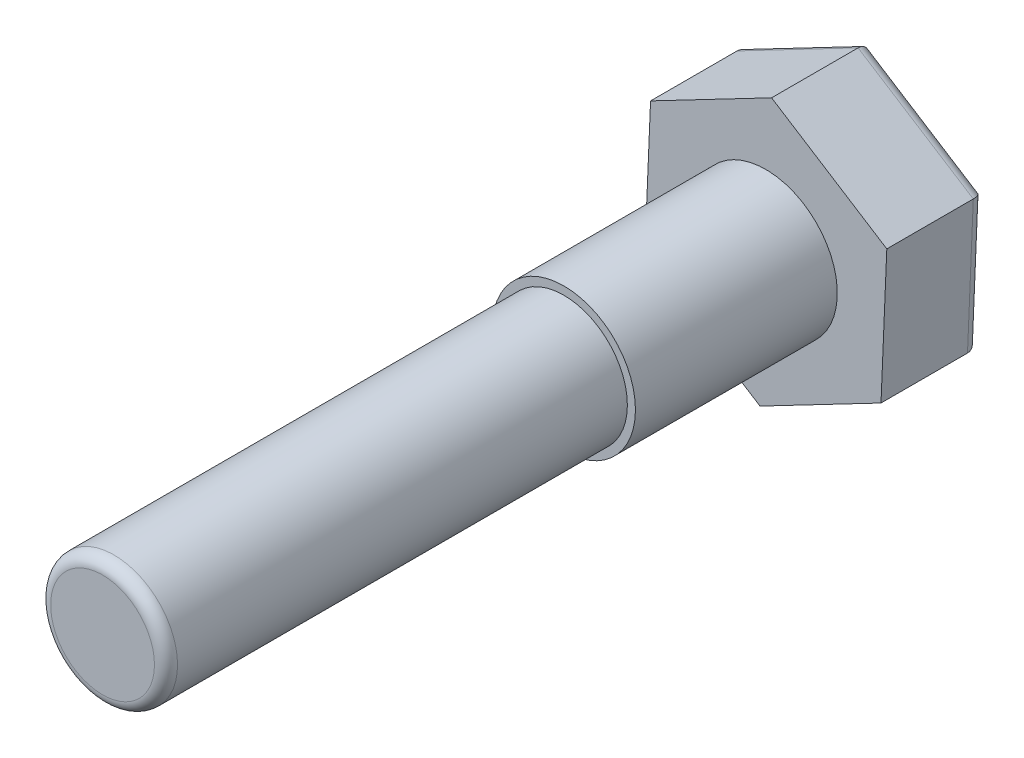
from build123d import *

# Parameters (mm, degrees)
EXTRUDE_307_DEPTH = 17
SKETCH_2_R        = 12.4
EXTRUDE_1_DEPTH   = 35
FILLET_3_R        = 2
SKETCH_3_R        = 11
EXTRUDE_2_DEPTH   = 80
FILLET_4_R        = 2


with BuildPart() as part:
    # 草图1 → Extrude 307 (new body)
    with BuildSketch(Plane.XY):
        Polygon((20.984201837, 10.954296262), (1.005402075, 23.65), (-19.978799762, 12.695703738), (-20.984201837, -10.954296262), (-1.005402075, -23.65), (19.978799762, -12.695703738), align=None)
    extrude(amount=EXTRUDE_307_DEPTH)

    # 草图2 → 凸台-拉伸1 (add)
    with BuildSketch(Plane.XY.offset(17)):
        Circle(SKETCH_2_R)
    extrude(amount=EXTRUDE_1_DEPTH)

    # 圆角3
    fillet_3_edges = [part.edges().sort_by_distance(p)[0] for p in [
        (10.994801956, 17.302148131, 0),
        (-9.486698843, 18.172851869, 0),
        (-20.4815008, 0.870703738, 0),
        (-10.994801956, -17.302148131, 0),
        (9.486698843, -18.172851869, 0),
        (20.4815008, -0.870703738, 0),
    ]]
    fillet(fillet_3_edges, radius=FILLET_3_R)

    # 草图3 → 凸台-拉伸2 (add)
    with BuildSketch(Plane.XY.offset(52)):
        Circle(SKETCH_3_R)
    extrude(amount=EXTRUDE_2_DEPTH)

    # 圆角4
    fillet_4_edges = [part.edges().sort_by_distance(p)[0] for p in [
        (-11, 0, 132),
    ]]
    fillet(fillet_4_edges, radius=FILLET_4_R)


solid = part.part
